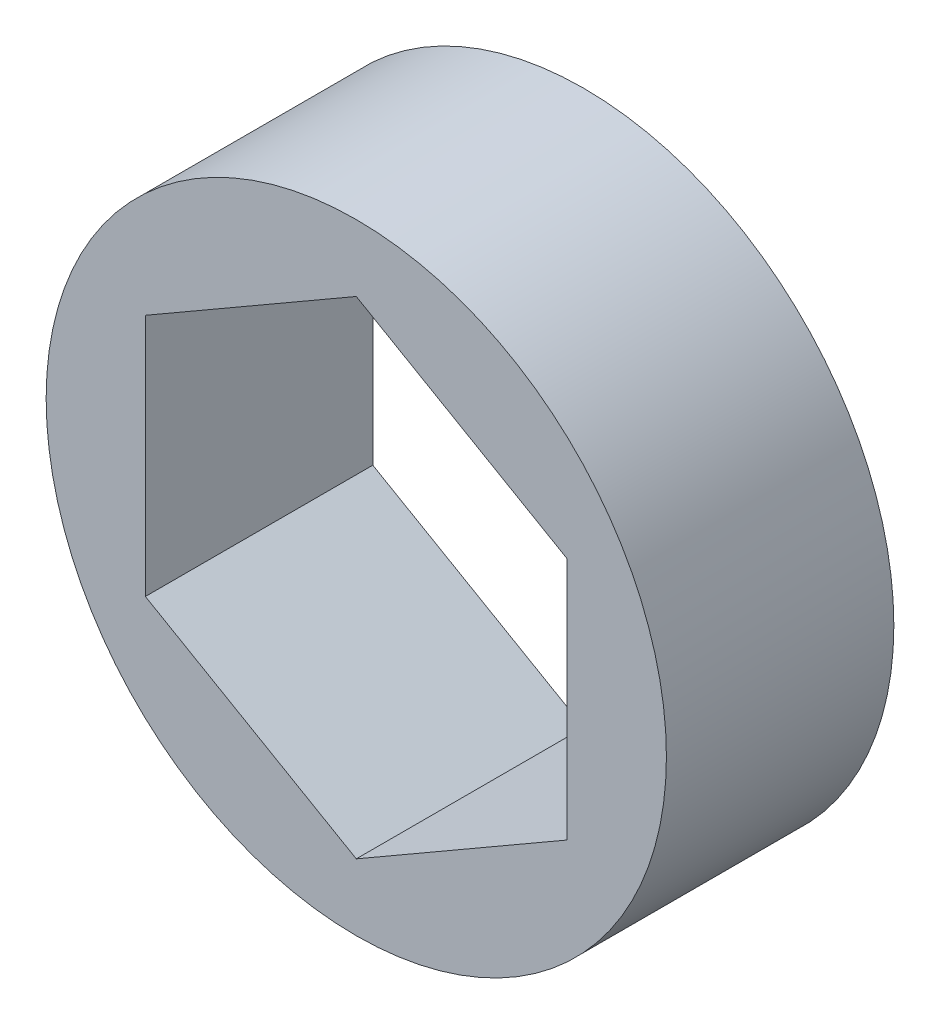
from build123d import *

# Parameters (mm, degrees)
SKETCH1_R           = 9.525
BOSS_EXTRUDE1_DEPTH = 3.4925


with BuildPart() as part:
    # Sketch1 → Boss-Extrude1 (new, symmetric)
    with BuildSketch(Plane.XY):
        Circle(SKETCH1_R)
        Polygon((0, 7.478995387), (-6.477, 3.739497694), (-6.477, -3.739497694), (0, -7.478995387), (6.477, -3.739497694), (6.477, 3.739497694), align=None, mode=Mode.SUBTRACT)
    extrude(amount=BOSS_EXTRUDE1_DEPTH, both=True)


solid = part.part
